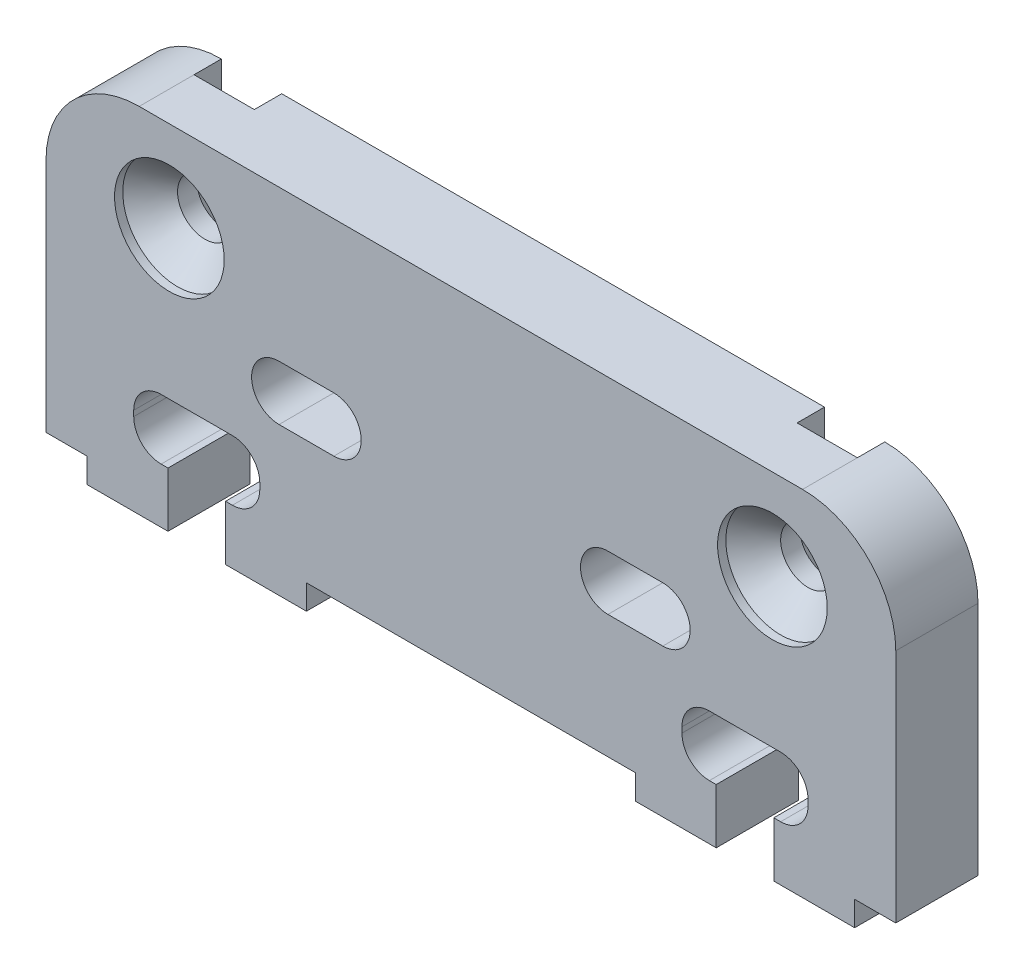
from build123d import *

# Parameters (mm, degrees)
BASE_SHAPE_DEPTH                               = 3
EDGE_RADIUSES_R                                = 3.4
CAMERA_MOUNT_POCKETS_DEPTH                     = 1
CAMERA_MOUNT_HOLES_REACH                       = 19.084
SKETCH3_R                                      = 1
CSK_FOR_M2_FLAT_HEAD_MACHINE_SCREW1_AT_2_COUNT = 2
CSK_FOR_M2_FLAT_HEAD_MACHINE_SCREW1_AT_2_PITCH = 22
F_1MM_MILLING_RADIUSES_R                       = 1


with BuildPart() as part:
    # Sketch1 → Base shape (new body)
    with BuildSketch(Plane.XY):
        Polygon((15.5, 6), (-15.5, 6), (-15.5, -6), (-14, -6), (-14, -6.9), (-11.05, -6.9), (-11.05, -4.9), (-12.3, -4.9), (-12.3, -2.7), (-7.7, -2.7), (-7.7, -4.9), (-8.95, -4.9), (-8.95, -6.9), (-6, -6.9), (-6, -6), (6, -6), (6, -6.9), (8.95, -6.9), (8.95, -4.9), (7.7, -4.9), (7.7, -2.7), (12.3, -2.7), (12.3, -4.9), (11.05, -4.9), (11.05, -6.9), (14, -6.9), (14, -6), (15.5, -6), align=None)
        with BuildLine():
            Line((-5, -1.5), (-7, -1.5))
            ThreePointArc((-7, -1.5), (-8, -0.5), (-7, 0.5))
            Line((-7, 0.5), (-5, 0.5))
            ThreePointArc((-5, 0.5), (-4, -0.5), (-5, -1.5))
        make_face(mode=Mode.SUBTRACT)
        with BuildLine():
            ThreePointArc((7, 0.5), (8, -0.5), (7, -1.5))
            Line((7, -1.5), (5, -1.5))
            ThreePointArc((5, -1.5), (4, -0.5), (5, 0.5))
            Line((5, 0.5), (7, 0.5))
        make_face(mode=Mode.SUBTRACT)
    extrude(amount=BASE_SHAPE_DEPTH)

    # Edge radiuses
    edge_radiuses_edges = [part.edges().sort_by_distance(p)[0] for p in [
        (15.5, 6, 1.5),
        (-15.5, 6, 1.5),
    ]]
    fillet(edge_radiuses_edges, radius=EDGE_RADIUSES_R)

    # Sketch2 → Camera mount pockets (cut)
    with BuildSketch(Plane(origin=(0, 0, 0), x_dir=(-1, 0, 0), z_dir=(0, 0, -1))):
        with BuildLine():
            Line((-12.1, 6.1), (-9.9, 6.1))
            Line((-9.9, 6.1), (-9.9, 0.3))
            ThreePointArc((-9.9, 0.3), (-10.192893219, -0.407106781), (-10.9, -0.7))
            Line((-10.9, -0.7), (-11.1, -0.7))
            ThreePointArc((-11.1, -0.7), (-11.807106781, -0.407106781), (-12.1, 0.3))
            Line((-12.1, 0.3), (-12.1, 6.1))
        make_face()
        with BuildLine():
            Line((12.1, 6.1), (9.9, 6.1))
            Line((9.9, 6.1), (9.9, 0.3))
            ThreePointArc((9.9, 0.3), (10.192893219, -0.407106781), (10.9, -0.7))
            Line((10.9, -0.7), (11.1, -0.7))
            ThreePointArc((11.1, -0.7), (11.807106781, -0.407106781), (12.1, 0.3))
            Line((12.1, 0.3), (12.1, 6.1))
        make_face()
    extrude(amount=-CAMERA_MOUNT_POCKETS_DEPTH, mode=Mode.SUBTRACT)

    # Sketch3 → Camera mount holes (cut, up to next)
    with BuildSketch(Plane(origin=(0, 0, 1), x_dir=(-1, 0, 0), z_dir=(0, 0, -1)), mode=Mode.PRIVATE) as camera_mount_holes_sk1:
        with Locations((-11, 2.7)):
            Circle(SKETCH3_R)
    camera_mount_holes_tool1 = extrude(camera_mount_holes_sk1.sketch, amount=-CAMERA_MOUNT_HOLES_REACH, mode=Mode.PRIVATE) & part.part
    # Sketch3 → Camera mount holes (cut, up to next)
    with BuildSketch(Plane(origin=(0, 0, 1), x_dir=(-1, 0, 0), z_dir=(0, 0, -1)), mode=Mode.PRIVATE) as camera_mount_holes_sk2:
        with Locations((11, 2.7)):
            Circle(SKETCH3_R)
    camera_mount_holes_tool2 = extrude(camera_mount_holes_sk2.sketch, amount=-CAMERA_MOUNT_HOLES_REACH, mode=Mode.PRIVATE) & part.part
    add(camera_mount_holes_tool1.solids().sort_by_distance((11, 2.7, 1))[0], mode=Mode.SUBTRACT)
    add(camera_mount_holes_tool2.solids().sort_by_distance((-11, 2.7, 1))[0], mode=Mode.SUBTRACT)

    # Sketch5 → CSK for M2 Flat Head Machine Screw1 (revolve, cut)
    with BuildSketch(Plane(origin=(-11, 2.7, 3), x_dir=(0, -1, 0), z_dir=(1, 0, 0))):
        Polygon((0, 0), (0, 3), (1, 3), (1, 1.3), (2, 0.3), (2, 0), align=None)
    csk_for_m2_flat_head_machine_screw1 = revolve(axis=Axis((-11, 2.7, 9.35), (0, 0, -1)), mode=Mode.SUBTRACT)

    # CSK for M2 Flat Head Machine Screw1 at 2: CSK for M2 Flat Head Machine Screw1 ×2
    with Locations(*[(i * CSK_FOR_M2_FLAT_HEAD_MACHINE_SCREW1_AT_2_PITCH, 0, 0) for i in range(1, CSK_FOR_M2_FLAT_HEAD_MACHINE_SCREW1_AT_2_COUNT)]):
        add(csk_for_m2_flat_head_machine_screw1, mode=Mode.SUBTRACT)

    # 1mm milling radiuses
    f_1mm_milling_radiuses_edges = [part.edges().sort_by_distance(p)[0] for p in [
        (-7.7, -2.7, 1.5),
        (-7.7, -4.9, 1.5),
        (12.3, -4.9, 1.5),
        (12.3, -2.7, 1.5),
        (7.7, -2.7, 1.5),
        (7.7, -4.9, 1.5),
        (-12.3, -4.9, 1.5),
        (-12.3, -2.7, 1.5),
    ]]
    fillet(f_1mm_milling_radiuses_edges, radius=F_1MM_MILLING_RADIUSES_R)


solid = part.part
